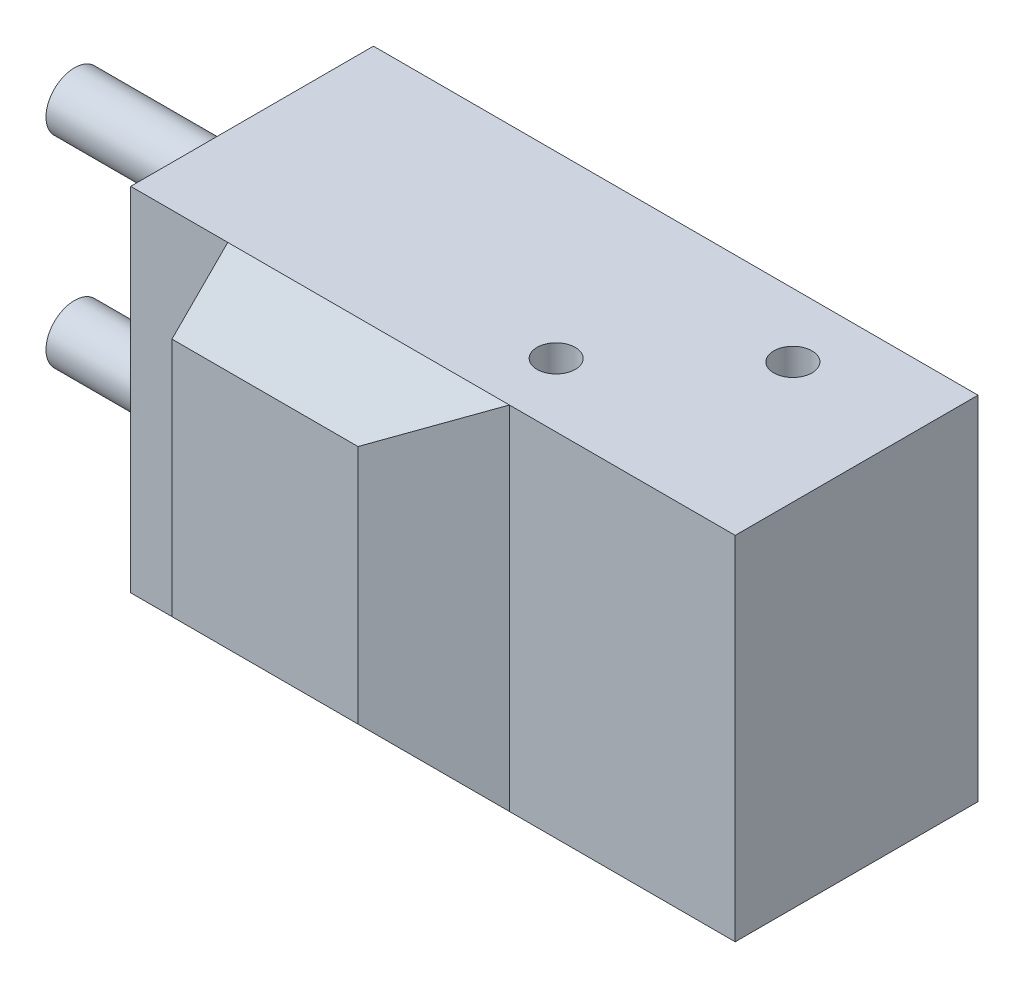
from build123d import *

# Parameters (mm, degrees)
SKETCH1_W                      = 63.246
SKETCH1_H                      = 36.83
EXTRUDE1_DEPTH                 = 25.4
M4X0_7_TAPPED_HOLE1_AT_2_COUNT = 2
M4X0_7_TAPPED_HOLE1_AT_2_PITCH = 17.517255065
M4X0_7_TAPPED_HOLE2_AT_2_COUNT = 2
M4X0_7_TAPPED_HOLE2_AT_2_PITCH = 17.517255065
SKETCH6_W                      = 29.464
SKETCH6_H                      = 36.83
EXTRUDE2_DEPTH                 = 5.842
CHAMFER1_SIZE                  = 5.842
CHAMFER2_SIZE                  = 5.842
CHAMFER3_SIZE2                 = 5.842
CHAMFER3_SIZE                  = 10
SKETCH7_R                      = 2.97815
EXTRUDE3_DEPTH                 = 18.5801


with BuildPart() as part:
    # Sketch1 → Extrude1 (new body)
    with BuildSketch(Plane.XY):
        with Locations((31.623, 18.415)):
            Rectangle(SKETCH1_W, SKETCH1_H)
    extrude(amount=EXTRUDE1_DEPTH)

    # Sketch2 → M4x0.7 Tapped Hole1 (revolve, cut)
    with BuildSketch(Plane(origin=(37.846, 0, 6.6675), x_dir=(0, 0, -1), z_dir=(1, 0, 0))):
        Polygon((0, 0), (0, 6.071420021), (1.65, 5.08), (1.65, 8.0000094), (2, 8.0000094), (2, 0), align=None)
    m4x0_7_tapped_hole1 = revolve(axis=Axis((37.846, -6.35, 6.6675), (0, 1, 0)), mode=Mode.SUBTRACT)

    # M4x0.7 Tapped Hole1 at 2: M4x0.7 Tapped Hole1 ×2
    with Locations(*[Vector(0.7249994335944138, 0, 0.6887494619146932) * (i * M4X0_7_TAPPED_HOLE1_AT_2_PITCH) for i in range(1, M4X0_7_TAPPED_HOLE1_AT_2_COUNT)]):
        add(m4x0_7_tapped_hole1, mode=Mode.SUBTRACT)

    # Sketch5 → M4x0.7 Tapped Hole2 (revolve, cut)
    with BuildSketch(Plane(origin=(50.546, 36.83, 6.6675), x_dir=(0, 0, 1), z_dir=(1, 0, 0))):
        Polygon((0, 0), (0, 6.071420021), (1.65, 5.08), (1.65, 8.0000094), (2, 8.0000094), (2, 0), align=None)
    m4x0_7_tapped_hole2 = revolve(axis=Axis((50.546, 43.18, 6.6675), (0, -1, 0)), mode=Mode.SUBTRACT)

    # M4x0.7 Tapped Hole2 at 2: M4x0.7 Tapped Hole2 ×2
    with Locations(*[Vector(-0.7249994335944137, 0, 0.6887494619146932) * (i * M4X0_7_TAPPED_HOLE2_AT_2_PITCH) for i in range(1, M4X0_7_TAPPED_HOLE2_AT_2_COUNT)]):
        add(m4x0_7_tapped_hole2, mode=Mode.SUBTRACT)

    # Sketch6 → Extrude2 (add)
    with BuildSketch(Plane.XY.offset(25.4)):
        with Locations((24.892, 18.415)):
            Rectangle(SKETCH6_W, SKETCH6_H)
    extrude(amount=EXTRUDE2_DEPTH)

    # Chamfer1
    chamfer1_edges = [part.edges().sort_by_distance(p)[0] for p in [
        (24.892, 0, 31.242),
    ]]
    chamfer(chamfer1_edges, length=CHAMFER1_SIZE)

    # Chamfer2
    chamfer2_edges = [part.edges().sort_by_distance(p)[0] for p in [
        (24.892, 36.83, 31.242),
    ]]
    chamfer(chamfer2_edges, length=CHAMFER2_SIZE)

    # Chamfer3
    chamfer3_edges = [part.edges().sort_by_distance(p)[0] for p in [
        (39.624, 18.415, 31.242),
    ]]
    chamfer3_side = [part.faces().sort_by_distance(p)[0] for p in [
        (39.50716, 18.415, 31.242),
    ]]
    chamfer(chamfer3_edges, length=CHAMFER3_SIZE - 0.0001, length2=CHAMFER3_SIZE2 - 0.0001, reference=chamfer3_side[0])  # a hair under: the kernel refuses the full size

    # Sketch7 → Extrude3 (add)
    with BuildSketch(Plane.ZY):
        with Locations(Location((12.7, 28.956, 0), (0, 0, 180))):
            Circle(SKETCH7_R)
        with Locations(Location((12.7, 7.874, 0), (0, 0, 180))):
            Circle(SKETCH7_R)
    extrude(amount=EXTRUDE3_DEPTH)


solid = part.part
